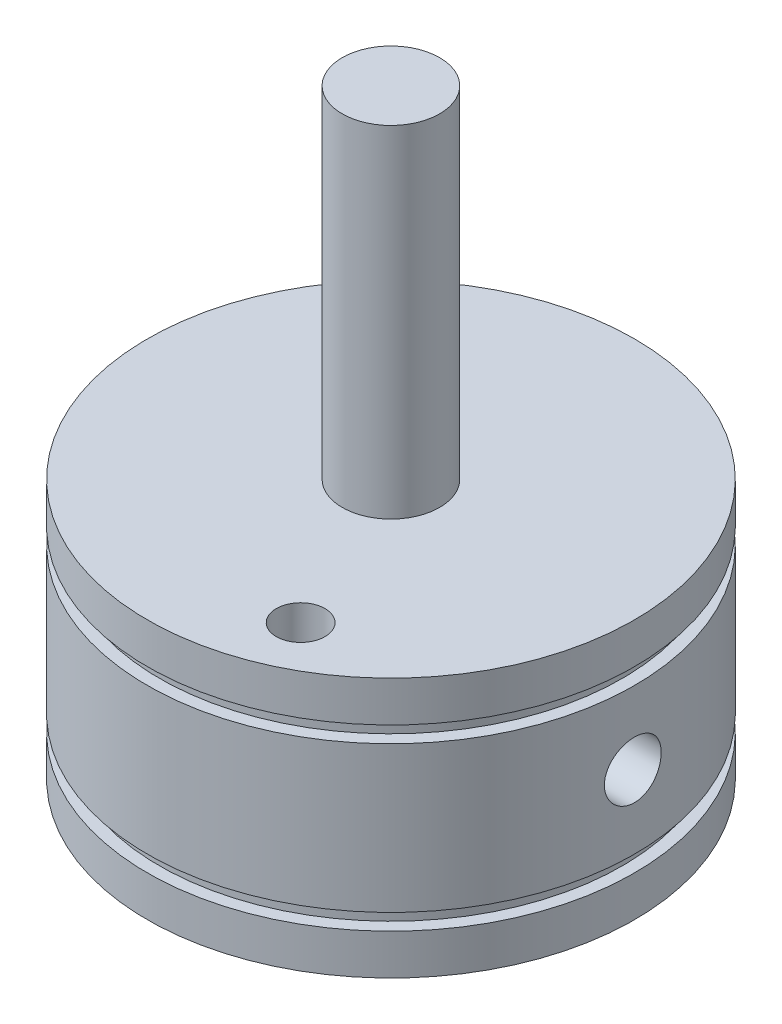
from build123d import *

# Parameters (mm, degrees)
ESBO_O2_R                         = 2.75
CORTE_EXTRUS_O2_DEPTH             = 15
ESBO_O3_R                         = 1.75
CORTE_EXTRUS_O3_DEPTH             = 15
ESBO_O7_R                         = 2.75
CORTE_EXTRUS_O6_DEPTH             = 15
CORTE_EXTRUS_O7_REACH             = 37.93
ESBO_O16_R                        = 1.5
CORTE_EXTRUS_O7_DIRECTION_2_DEPTH = 2


with BuildPart() as part:
    # Esboço1 → Revolução1 (revolve)
    with BuildSketch(Plane.XY, mode=Mode.PRIVATE) as revolu_o1_sk:
        Polygon((0, 29), (3, 29), (3, 8), (15, 8), (15, 5.5), (14.25, 5.5), (14.25, 4.5), (15, 4.5), (15, -4.5), (14.25, -4.5), (14.25, -5.5), (15, -5.5), (15, -8), (3, -8), (3, -12.5), (0, -12.5), (0, 0), align=None)
    revolve(revolu_o1_sk.sketch.rotate(Axis((0, 0, 0), (0, 1, 0)), 90), axis=Axis((0, 0, 0), (0, 1, 0)))

    # Esboço2 → Corte-extrusão2 (cut)
    with BuildSketch(Plane.ZY.offset(15)):
        Circle(ESBO_O2_R)
    extrude(amount=-CORTE_EXTRUS_O2_DEPTH, mode=Mode.SUBTRACT)

    # Esboço3 → Corte-extrusão3 (cut)
    with BuildSketch(Plane(origin=(15, 0, 0), x_dir=(0, 0, -1), z_dir=(1, 0, 0))):
        Circle(ESBO_O3_R)
    extrude(amount=-CORTE_EXTRUS_O3_DEPTH, mode=Mode.SUBTRACT)

    # Esboço7 → Corte-extrusão6 (cut)
    with BuildSketch(Plane(origin=(-13.594616806, 0, 6.339273926), x_dir=(0, -1, 0), z_dir=(-0.9063077870366554, 0, 0.42261826174068795))):
        with Locations(Location((0, 0, 0), (0, 0, 90))):
            Circle(ESBO_O7_R)
    extrude(amount=-CORTE_EXTRUS_O6_DEPTH, mode=Mode.SUBTRACT)

    # Loft de corte1: read off the stored shape, not the designer's step
    # Loft de corte1: loft between two sections, ruled curve by curve
    loft_de_corte1_from = [
        Edge.make_bspline([(-15.295076885, 2.749999989, 0.060071349), (-15.17249314, 2.749999989, 0.66258971), (-14.953315291, 2.749999989, 1.739883252), (-14.647908714, 2.749999989, 3.241004535), (-14.342502138, 2.749999989, 4.742125818), (-14.123324289, 2.749999989, 5.81941936), (-13.936334432, 2.749999989, 6.738503875), (-13.802793891, 2.634982398, 7.394876604), (-13.6178115, 2.069764064, 8.304094103), (-13.484895506, 1.144964937, 8.957397085), (-13.436205498, -9e-09, 9.196716122), (-13.484895506, -1.144964955, 8.957397085), (-13.6178115, -2.069764082, 8.304094103), (-13.802793891, -2.634982417, 7.394876604), (-13.936334432, -2.750000008, 6.738503875), (-14.123324289, -2.750000008, 5.81941936), (-14.342502138, -2.750000008, 4.742125818), (-14.647908714, -2.750000008, 3.241004535), (-14.953315291, -2.750000008, 1.739883252), (-15.17249314, -2.750000008, 0.66258971), (-15.359482997, -2.750000008, -0.256494805), (-15.493023538, -2.634982417, -0.912867534), (-15.678005929, -2.069764082, -1.822085033), (-15.810921923, -1.144964955, -2.475388015), (-15.859611931, -9e-09, -2.714707051), (-15.810921923, 1.144964937, -2.475388015), (-15.678005929, 2.069764064, -1.822085033), (-15.493023538, 2.634982398, -0.912867534), (-15.359482997, 2.749999989, -0.256494805), (-15.295076885, 2.749999989, 0.060071349)], [0, 0, 0, 0, 0.060951527, 0.121903054, 0.182854581, 0.243806108, 0.243806108, 0.275830344, 0.307854581, 0.339878817, 0.371903054, 0.40392729, 0.435951527, 0.467975763, 0.5, 0.5, 0.560951527, 0.621903054, 0.682854581, 0.743806108, 0.743806108, 0.775830344, 0.807854581, 0.839878817, 0.871903054, 0.90392729, 0.935951527, 0.967975763, 1, 1, 1, 1], 3),
    ]
    loft_de_corte1_to = [
        Edge.make_bspline([(0, 1.798514694, -2.080347302), (0, 2.064084712, -1.85075507), (0, 2.548665, -1.252264579), (0, 2.851864048, 0), (0, 2.548665, 1.252264579), (0, 2.064084712, 1.85075507), (0, 1.65898288, 2.200976207), (0, 1.371366644, 2.402732798), (0, 0.922287519, 2.60477597), (0, 0.463556687, 2.724139362), (0, 0, 2.763151113), (0, -0.463556687, 2.724139362), (0, -0.922287519, 2.60477597), (0, -1.371366644, 2.402732798), (0, -1.65898288, 2.200976207), (0, -2.064084712, 1.85075507), (0, -2.548665, 1.252264579), (0, -2.851864048, 0), (0, -2.548665, -1.252264579), (0, -2.064084712, -1.85075507), (0, -1.65898288, -2.200976207), (0, -1.371366644, -2.402732798), (0, -0.922287519, -2.60477597), (0, -0.463556687, -2.724139362), (0, 0, -2.763151113), (0, 0.463556687, -2.724139362), (0, 0.922287519, -2.60477597), (0, 1.371366644, -2.402732798), (0, 1.65898288, -2.200976207), (0, 1.798514694, -2.080347302)], [0, 0, 0, 0, 0.060951527, 0.121903054, 0.182854581, 0.243806108, 0.243806108, 0.275830344, 0.307854581, 0.339878817, 0.371903054, 0.40392729, 0.435951527, 0.467975763, 0.5, 0.5, 0.560951527, 0.621903054, 0.682854581, 0.743806108, 0.743806108, 0.775830344, 0.807854581, 0.839878817, 0.871903054, 0.90392729, 0.935951527, 0.967975763, 1, 1, 1, 1], 3),
    ]
    loft_de_corte1 = Solid(Shell([*[Face.make_surface_from_curves(loft_de_corte1_from[k], loft_de_corte1_to[k]) for k in range(1)], Face(Wire(loft_de_corte1_from)), Face(Wire(loft_de_corte1_to))]))
    add(loft_de_corte1, mode=Mode.SUBTRACT)

    # Loft de corte1 2: loft between two sections, ruled curve by curve
    loft_de_corte1_2_from = [
        Edge.make_bspline([(-15.295076885, 2.749999989, 0.060071349), (-15.17249314, 2.749999989, 0.66258971), (-14.953315291, 2.749999989, 1.739883252), (-14.647908714, 2.749999989, 3.241004535), (-14.342502138, 2.749999989, 4.742125818), (-14.123324289, 2.749999989, 5.81941936), (-13.936334432, 2.749999989, 6.738503875), (-13.802793891, 2.634982398, 7.394876604), (-13.6178115, 2.069764064, 8.304094103), (-13.484895506, 1.144964937, 8.957397085), (-13.436205498, -9e-09, 9.196716122), (-13.484895506, -1.144964955, 8.957397085), (-13.6178115, -2.069764082, 8.304094103), (-13.802793891, -2.634982417, 7.394876604), (-13.936334432, -2.750000008, 6.738503875), (-14.123324289, -2.750000008, 5.81941936), (-14.342502138, -2.750000008, 4.742125818), (-14.647908714, -2.750000008, 3.241004535), (-14.953315291, -2.750000008, 1.739883252), (-15.17249314, -2.750000008, 0.66258971), (-15.359482997, -2.750000008, -0.256494805), (-15.493023538, -2.634982417, -0.912867534), (-15.678005929, -2.069764082, -1.822085033), (-15.810921923, -1.144964955, -2.475388015), (-15.859611931, -9e-09, -2.714707051), (-15.810921923, 1.144964937, -2.475388015), (-15.678005929, 2.069764064, -1.822085033), (-15.493023538, 2.634982398, -0.912867534), (-15.359482997, 2.749999989, -0.256494805), (-15.295076885, 2.749999989, 0.060071349)], [0, 0, 0, 0, 0.060951527, 0.121903054, 0.182854581, 0.243806108, 0.243806108, 0.275830344, 0.307854581, 0.339878817, 0.371903054, 0.40392729, 0.435951527, 0.467975763, 0.5, 0.5, 0.560951527, 0.621903054, 0.682854581, 0.743806108, 0.743806108, 0.775830344, 0.807854581, 0.839878817, 0.871903054, 0.90392729, 0.935951527, 0.967975763, 1, 1, 1, 1], 3),
    ]
    loft_de_corte1_2_to = [
        Edge.make_bspline([(0, 1.798514694, -2.080347302), (0, 2.064084712, -1.85075507), (0, 2.548665, -1.252264579), (0, 2.851864048, 0), (0, 2.548665, 1.252264579), (0, 2.064084712, 1.85075507), (0, 1.65898288, 2.200976207), (0, 1.371366644, 2.402732798), (0, 0.922287519, 2.60477597), (0, 0.463556687, 2.724139362), (0, 0, 2.763151113), (0, -0.463556687, 2.724139362), (0, -0.922287519, 2.60477597), (0, -1.371366644, 2.402732798), (0, -1.65898288, 2.200976207), (0, -2.064084712, 1.85075507), (0, -2.548665, 1.252264579), (0, -2.851864048, 0), (0, -2.548665, -1.252264579), (0, -2.064084712, -1.85075507), (0, -1.65898288, -2.200976207), (0, -1.371366644, -2.402732798), (0, -0.922287519, -2.60477597), (0, -0.463556687, -2.724139362), (0, 0, -2.763151113), (0, 0.463556687, -2.724139362), (0, 0.922287519, -2.60477597), (0, 1.371366644, -2.402732798), (0, 1.65898288, -2.200976207), (0, 1.798514694, -2.080347302)], [0, 0, 0, 0, 0.060951527, 0.121903054, 0.182854581, 0.243806108, 0.243806108, 0.275830344, 0.307854581, 0.339878817, 0.371903054, 0.40392729, 0.435951527, 0.467975763, 0.5, 0.5, 0.560951527, 0.621903054, 0.682854581, 0.743806108, 0.743806108, 0.775830344, 0.807854581, 0.839878817, 0.871903054, 0.90392729, 0.935951527, 0.967975763, 1, 1, 1, 1], 3),
    ]
    loft_de_corte1_2 = Solid(Shell([*[Face.make_surface_from_curves(loft_de_corte1_2_from[k], loft_de_corte1_2_to[k]) for k in range(1)], Face(Wire(loft_de_corte1_2_from)), Face(Wire(loft_de_corte1_2_to))]))
    add(loft_de_corte1_2, mode=Mode.SUBTRACT)

    # Esboço15 → Corte-Revolução1 (revolve, cut)
    with BuildSketch(Plane(origin=(0, 0, 0), x_dir=(1, 0, 0), z_dir=(0, 1, 0))):
        Polygon((0, 1.75), (0, 2.75), (6.5, 1.75), align=None)
    revolve(axis=Axis((0, 0, 0), (1, 0, 0)), mode=Mode.SUBTRACT)

    # Esboço16 → Corte-extrusão7 (cut, up to next)
    with BuildSketch(Plane(origin=(0, 0, 0), x_dir=(1, 0, 0), z_dir=(0, 1, 0)), mode=Mode.PRIVATE) as corte_extrus_o7_sk1:
        with Locations(Location((4.86011001, -10.422539551, 0), (0, 0, 270))):
            Circle(ESBO_O16_R)
    corte_extrus_o7_tool1 = extrude(corte_extrus_o7_sk1.sketch, amount=CORTE_EXTRUS_O7_REACH, mode=Mode.PRIVATE) & part.part
    add(corte_extrus_o7_tool1.solids().sort_by_distance((4.86011, 0, 10.42254))[0], mode=Mode.SUBTRACT)

    # Esboço16 → Corte-extrusão7 direction 2 (cut)
    with BuildSketch(Plane(origin=(0, 0, 0), x_dir=(1, 0, 0), z_dir=(0, 1, 0))):
        with Locations(Location((4.86011001, -10.422539551, 0), (0, 0, 270))):
            Circle(ESBO_O16_R)
    extrude(amount=-CORTE_EXTRUS_O7_DIRECTION_2_DEPTH, mode=Mode.SUBTRACT)


solid = part.part
